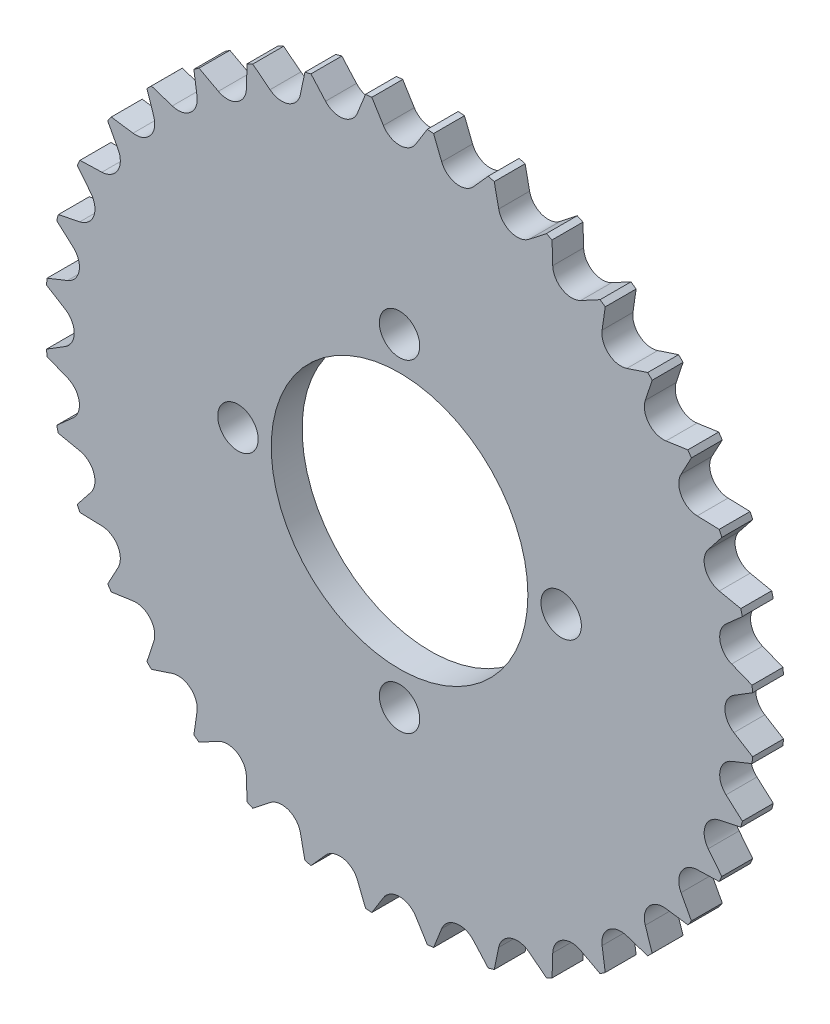
from build123d import *

# Parameters (mm, degrees)
BOSS_EXTRUDE1_DEPTH = 6.5
SKETCH9_R           = 100
SKETCH9_R_2         = 74.5
CUT_EXTRUDE5_DEPTH  = 10
SKETCH10_R          = 27
SKETCH10_R_2        = 4.25
CUT_EXTRUDE6_DEPTH  = 106.236415957


with BuildPart() as part:
    # Sketch1 → Boss-Extrude1 (new body)
    with BuildSketch(Plane.XY):
        with BuildLine():
            ThreePointArc((3.400646872, 70.34391338), (0, 68.45), (-3.400646872, 70.34391338))
            Line((-3.400646872, 70.34391338), (-6.085453124, 74.679004775))
            ThreePointArc((-6.085453124, 74.679004775), (-6.554111855, 74.913841296), (-6.974871672, 74.601190735))
            Line((-6.974871672, 74.601190735), (-8.866108963, 69.865747406))
            ThreePointArc((-8.866108963, 69.865747406), (-11.886217761, 67.410090694), (-15.564075773, 68.684715142))
            Line((-15.564075773, 68.684715142), (-18.960874506, 72.487735044))
            ThreePointArc((-18.960874506, 72.487735044), (-19.463192192, 72.637622137), (-19.823268522, 72.256657264))
            Line((-19.823268522, 72.256657264), (-20.863472565, 67.264746051))
            ThreePointArc((-20.863472565, 67.264746051), (-23.411278811, 64.321959893), (-27.254598108, 64.93856659))
            Line((-27.254598108, 64.93856659), (-31.260179312, 68.093962165))
            ThreePointArc((-31.260179312, 68.093962165), (-31.780893283, 68.154345585), (-32.069345388, 67.716641827))
            Line((-32.069345388, 67.716641827), (-32.226910109, 62.619939425))
            ThreePointArc((-32.226910109, 62.619939425), (-34.225, 59.279438889), (-38.117003271, 59.219292553))
            Line((-38.117003271, 59.219292553), (-42.609659387, 61.631188702))
            ThreePointArc((-42.609659387, 61.631188702), (-43.132948014, 61.600233731), (-43.341011423, 61.119090493))
            Line((-43.341011423, 61.119090493), (-42.611149298, 56.072457626))
            ThreePointArc((-42.611149298, 56.072457626), (-43.998811883, 52.435742131), (-47.821242577, 51.700670278))
            Line((-47.821242577, 51.700670278), (-52.664466523, 53.295782758))
            ThreePointArc((-52.664466523, 53.295782758), (-53.174429945, 53.174429945), (-53.295782758, 52.664466523))
            Line((-53.295782758, 52.664466523), (-51.700670278, 47.821242577))
            ThreePointArc((-51.700670278, 47.821242577), (-52.435742131, 43.998811883), (-56.072457626, 42.611149298))
            Line((-56.072457626, 42.611149298), (-61.119090493, 43.341011423))
            ThreePointArc((-61.119090493, 43.341011423), (-61.600233731, 43.132948014), (-61.631188702, 42.609659387))
            Line((-61.631188702, 42.609659387), (-59.219292553, 38.117003271))
            ThreePointArc((-59.219292553, 38.117003271), (-59.279438889, 34.225), (-62.619939425, 32.226910109))
            Line((-62.619939425, 32.226910109), (-67.716641827, 32.069345388))
            ThreePointArc((-67.716641827, 32.069345388), (-68.154345585, 31.780893283), (-68.093962165, 31.260179312))
            Line((-68.093962165, 31.260179312), (-64.93856659, 27.254598108))
            ThreePointArc((-64.93856659, 27.254598108), (-64.321959893, 23.411278811), (-67.264746051, 20.863472565))
            Line((-67.264746051, 20.863472565), (-72.256657264, 19.823268522))
            ThreePointArc((-72.256657264, 19.823268522), (-72.637622137, 19.463192192), (-72.487735044, 18.960874506))
            Line((-72.487735044, 18.960874506), (-68.684715142, 15.564075773))
            ThreePointArc((-68.684715142, 15.564075773), (-67.410090694, 11.886217761), (-69.865747406, 8.866108963))
            Line((-69.865747406, 8.866108963), (-74.601190735, 6.974871672))
            ThreePointArc((-74.601190735, 6.974871672), (-74.913841296, 6.554111855), (-74.679004775, 6.085453124))
            Line((-74.679004775, 6.085453124), (-70.34391338, 3.400646872))
            ThreePointArc((-70.34391338, 3.400646872), (-68.45, 0), (-70.34391338, -3.400646872))
            Line((-70.34391338, -3.400646872), (-74.679004775, -6.085453124))
            ThreePointArc((-74.679004775, -6.085453124), (-74.913841296, -6.554111855), (-74.601190735, -6.974871672))
            Line((-74.601190735, -6.974871672), (-69.865747406, -8.866108963))
            ThreePointArc((-69.865747406, -8.866108963), (-67.410090694, -11.886217761), (-68.684715142, -15.564075773))
            Line((-68.684715142, -15.564075773), (-72.487735044, -18.960874506))
            ThreePointArc((-72.487735044, -18.960874506), (-72.637622137, -19.463192192), (-72.256657264, -19.823268522))
            Line((-72.256657264, -19.823268522), (-67.264746051, -20.863472565))
            ThreePointArc((-67.264746051, -20.863472565), (-64.321959893, -23.411278811), (-64.93856659, -27.254598108))
            Line((-64.93856659, -27.254598108), (-68.093962165, -31.260179312))
            ThreePointArc((-68.093962165, -31.260179312), (-68.154345585, -31.780893283), (-67.716641827, -32.069345388))
            Line((-67.716641827, -32.069345388), (-62.619939425, -32.226910109))
            ThreePointArc((-62.619939425, -32.226910109), (-59.279438889, -34.225), (-59.219292553, -38.117003271))
            Line((-59.219292553, -38.117003271), (-61.631188702, -42.609659387))
            ThreePointArc((-61.631188702, -42.609659387), (-61.600233731, -43.132948014), (-61.119090493, -43.341011423))
            Line((-61.119090493, -43.341011423), (-56.072457626, -42.611149298))
            ThreePointArc((-56.072457626, -42.611149298), (-52.435742131, -43.998811883), (-51.700670278, -47.821242577))
            Line((-51.700670278, -47.821242577), (-53.295782758, -52.664466523))
            ThreePointArc((-53.295782758, -52.664466523), (-53.174429945, -53.174429945), (-52.664466523, -53.295782758))
            Line((-52.664466523, -53.295782758), (-47.821242577, -51.700670278))
            ThreePointArc((-47.821242577, -51.700670278), (-43.998811883, -52.435742131), (-42.611149298, -56.072457626))
            Line((-42.611149298, -56.072457626), (-43.341011423, -61.119090493))
            ThreePointArc((-43.341011423, -61.119090493), (-43.132948014, -61.600233731), (-42.609659387, -61.631188702))
            Line((-42.609659387, -61.631188702), (-38.117003271, -59.219292553))
            ThreePointArc((-38.117003271, -59.219292553), (-34.225, -59.279438889), (-32.226910109, -62.619939425))
            Line((-32.226910109, -62.619939425), (-32.069345388, -67.716641827))
            ThreePointArc((-32.069345388, -67.716641827), (-31.780893283, -68.154345585), (-31.260179312, -68.093962165))
            Line((-31.260179312, -68.093962165), (-27.254598108, -64.93856659))
            ThreePointArc((-27.254598108, -64.93856659), (-23.411278811, -64.321959893), (-20.863472565, -67.264746051))
            Line((-20.863472565, -67.264746051), (-19.823268522, -72.256657264))
            ThreePointArc((-19.823268522, -72.256657264), (-19.463192192, -72.637622137), (-18.960874506, -72.487735044))
            Line((-18.960874506, -72.487735044), (-15.564075773, -68.684715142))
            ThreePointArc((-15.564075773, -68.684715142), (-11.886217761, -67.410090694), (-8.866108963, -69.865747406))
            Line((-8.866108963, -69.865747406), (-6.974871672, -74.601190735))
            ThreePointArc((-6.974871672, -74.601190735), (-6.554111855, -74.913841296), (-6.085453124, -74.679004775))
            Line((-6.085453124, -74.679004775), (-3.400646872, -70.34391338))
            ThreePointArc((-3.400646872, -70.34391338), (0, -68.45), (3.400646872, -70.34391338))
            Line((3.400646872, -70.34391338), (6.085453124, -74.679004775))
            ThreePointArc((6.085453124, -74.679004775), (6.554111855, -74.913841296), (6.974871672, -74.601190735))
            Line((6.974871672, -74.601190735), (8.866108963, -69.865747406))
            ThreePointArc((8.866108963, -69.865747406), (11.886217761, -67.410090694), (15.564075773, -68.684715142))
            Line((15.564075773, -68.684715142), (18.960874506, -72.487735044))
            ThreePointArc((18.960874506, -72.487735044), (19.463192192, -72.637622137), (19.823268522, -72.256657264))
            Line((19.823268522, -72.256657264), (20.863472565, -67.264746051))
            ThreePointArc((20.863472565, -67.264746051), (23.411278811, -64.321959893), (27.254598108, -64.93856659))
            Line((27.254598108, -64.93856659), (31.260179312, -68.093962165))
            ThreePointArc((31.260179312, -68.093962165), (31.780893283, -68.154345585), (32.069345388, -67.716641827))
            Line((32.069345388, -67.716641827), (32.226910109, -62.619939425))
            ThreePointArc((32.226910109, -62.619939425), (34.225, -59.279438889), (38.117003271, -59.219292553))
            Line((38.117003271, -59.219292553), (42.609659387, -61.631188702))
            ThreePointArc((42.609659387, -61.631188702), (43.132948014, -61.600233731), (43.341011423, -61.119090493))
            Line((43.341011423, -61.119090493), (42.611149298, -56.072457626))
            ThreePointArc((42.611149298, -56.072457626), (43.998811883, -52.435742131), (47.821242577, -51.700670278))
            Line((47.821242577, -51.700670278), (52.664466523, -53.295782758))
            ThreePointArc((52.664466523, -53.295782758), (53.174429945, -53.174429945), (53.295782758, -52.664466523))
            Line((53.295782758, -52.664466523), (51.700670278, -47.821242577))
            ThreePointArc((51.700670278, -47.821242577), (52.435742131, -43.998811883), (56.072457626, -42.611149298))
            Line((56.072457626, -42.611149298), (61.119090493, -43.341011423))
            ThreePointArc((61.119090493, -43.341011423), (61.600233731, -43.132948014), (61.631188702, -42.609659387))
            Line((61.631188702, -42.609659387), (59.219292553, -38.117003271))
            ThreePointArc((59.219292553, -38.117003271), (59.279438889, -34.225), (62.619939425, -32.226910109))
            Line((62.619939425, -32.226910109), (67.716641827, -32.069345388))
            ThreePointArc((67.716641827, -32.069345388), (68.154345585, -31.780893283), (68.093962165, -31.260179312))
            Line((68.093962165, -31.260179312), (64.93856659, -27.254598108))
            ThreePointArc((64.93856659, -27.254598108), (64.321959893, -23.411278811), (67.264746051, -20.863472565))
            Line((67.264746051, -20.863472565), (72.256657264, -19.823268522))
            ThreePointArc((72.256657264, -19.823268522), (72.637622137, -19.463192192), (72.487735044, -18.960874506))
            Line((72.487735044, -18.960874506), (68.684715142, -15.564075773))
            ThreePointArc((68.684715142, -15.564075773), (67.410090694, -11.886217761), (69.865747406, -8.866108963))
            Line((69.865747406, -8.866108963), (74.601190735, -6.974871672))
            ThreePointArc((74.601190735, -6.974871672), (74.913841296, -6.554111855), (74.679004775, -6.085453124))
            Line((74.679004775, -6.085453124), (70.34391338, -3.400646872))
            ThreePointArc((70.34391338, -3.400646872), (68.45, 0), (70.34391338, 3.400646872))
            Line((70.34391338, 3.400646872), (74.679004775, 6.085453124))
            ThreePointArc((74.679004775, 6.085453124), (74.913841296, 6.554111855), (74.601190735, 6.974871672))
            Line((74.601190735, 6.974871672), (69.865747406, 8.866108963))
            ThreePointArc((69.865747406, 8.866108963), (67.410090694, 11.886217761), (68.684715142, 15.564075773))
            Line((68.684715142, 15.564075773), (72.487735044, 18.960874506))
            ThreePointArc((72.487735044, 18.960874506), (72.637622137, 19.463192192), (72.256657264, 19.823268522))
            Line((72.256657264, 19.823268522), (67.264746051, 20.863472565))
            ThreePointArc((67.264746051, 20.863472565), (64.321959893, 23.411278811), (64.93856659, 27.254598108))
            Line((64.93856659, 27.254598108), (68.093962165, 31.260179312))
            ThreePointArc((68.093962165, 31.260179312), (68.154345585, 31.780893283), (67.716641827, 32.069345388))
            Line((67.716641827, 32.069345388), (62.619939425, 32.226910109))
            ThreePointArc((62.619939425, 32.226910109), (59.279438889, 34.225), (59.219292553, 38.117003271))
            Line((59.219292553, 38.117003271), (61.631188702, 42.609659387))
            ThreePointArc((61.631188702, 42.609659387), (61.600233731, 43.132948014), (61.119090493, 43.341011423))
            Line((61.119090493, 43.341011423), (56.072457626, 42.611149298))
            ThreePointArc((56.072457626, 42.611149298), (52.435742131, 43.998811883), (51.700670278, 47.821242577))
            Line((51.700670278, 47.821242577), (53.295782758, 52.664466523))
            ThreePointArc((53.295782758, 52.664466523), (53.174429945, 53.174429945), (52.664466523, 53.295782758))
            Line((52.664466523, 53.295782758), (47.821242577, 51.700670278))
            ThreePointArc((47.821242577, 51.700670278), (43.998811883, 52.435742131), (42.611149298, 56.072457626))
            Line((42.611149298, 56.072457626), (43.341011423, 61.119090493))
            ThreePointArc((43.341011423, 61.119090493), (43.132948014, 61.600233731), (42.609659387, 61.631188702))
            Line((42.609659387, 61.631188702), (38.117003271, 59.219292553))
            ThreePointArc((38.117003271, 59.219292553), (34.225, 59.279438889), (32.226910109, 62.619939425))
            Line((32.226910109, 62.619939425), (32.069345388, 67.716641827))
            ThreePointArc((32.069345388, 67.716641827), (31.780893283, 68.154345585), (31.260179312, 68.093962165))
            Line((31.260179312, 68.093962165), (27.254598108, 64.93856659))
            ThreePointArc((27.254598108, 64.93856659), (23.411278811, 64.321959893), (20.863472565, 67.264746051))
            Line((20.863472565, 67.264746051), (19.823268522, 72.256657264))
            ThreePointArc((19.823268522, 72.256657264), (19.463192192, 72.637622137), (18.960874506, 72.487735044))
            Line((18.960874506, 72.487735044), (15.564075773, 68.684715142))
            ThreePointArc((15.564075773, 68.684715142), (11.886217761, 67.410090694), (8.866108963, 69.865747406))
            Line((8.866108963, 69.865747406), (6.974871672, 74.601190735))
            ThreePointArc((6.974871672, 74.601190735), (6.554111855, 74.913841296), (6.085453124, 74.679004775))
            Line((6.085453124, 74.679004775), (3.400646872, 70.34391338))
        make_face()
    extrude(amount=BOSS_EXTRUDE1_DEPTH)

    # Sketch9 → Cut-Extrude5 (cut)
    with BuildSketch(Plane(origin=(0, 0, 0), x_dir=(-1, 0, 0), z_dir=(0, 0, -1))):
        Circle(SKETCH9_R)
        Circle(SKETCH9_R_2, mode=Mode.SUBTRACT)
    extrude(amount=-CUT_EXTRUDE5_DEPTH, mode=Mode.SUBTRACT)

    # Sketch10 → Cut-Extrude6 (cut, through all)
    with BuildSketch(Plane.XY.offset(6.5)):
        Circle(SKETCH10_R)
        with Locations((0, 34)):
            Circle(SKETCH10_R_2)
        with Locations((34, 0)):
            Circle(SKETCH10_R_2)
        with Locations((0, -34)):
            Circle(SKETCH10_R_2)
        with Locations((-34, 0)):
            Circle(SKETCH10_R_2)
    extrude(amount=-CUT_EXTRUDE6_DEPTH, mode=Mode.SUBTRACT)


solid = part.part
